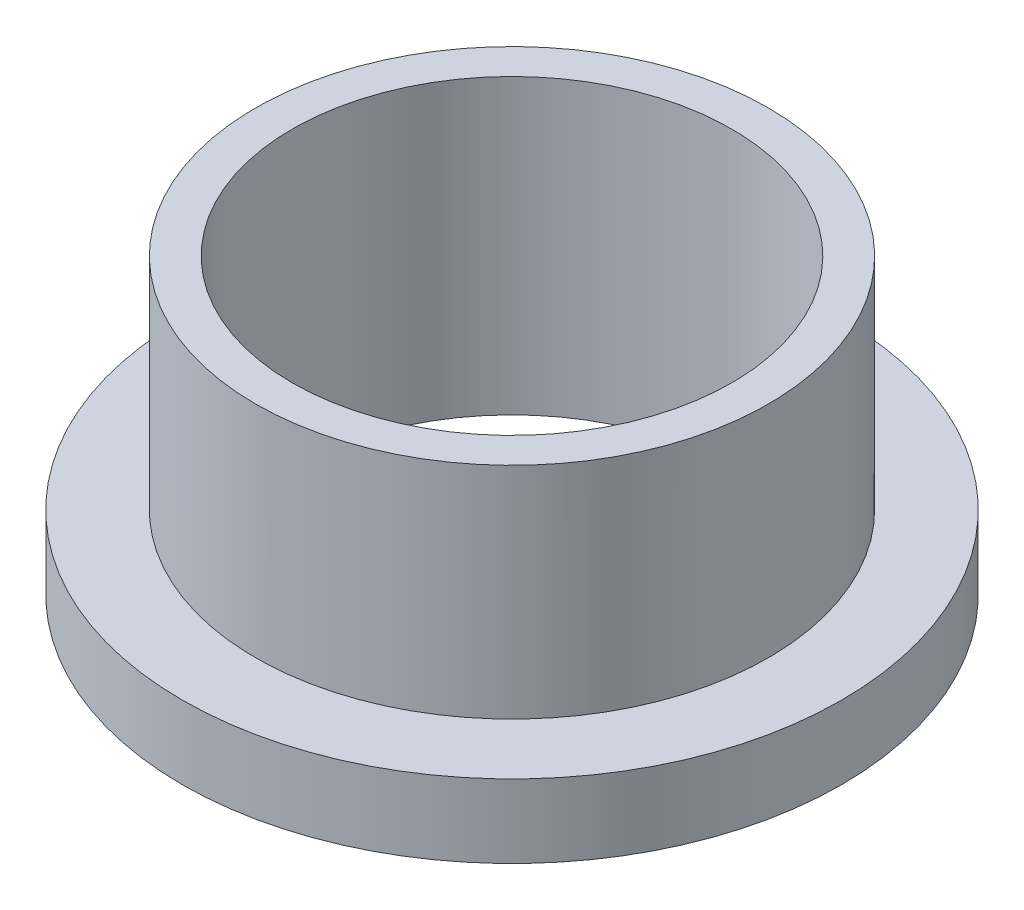
from build123d import *

# Parameters (mm, degrees)
SKETCH1_R           = 11.1125
SKETCH1_R_2         = 9.525
BOSS_EXTRUDE1_DEPTH = 12.7
SKETCH2_R           = 14.2875
SKETCH2_R_2         = 11.1125
BOSS_EXTRUDE2_DEPTH = 3.175


with BuildPart() as part:
    # Sketch1 → Boss-Extrude1 (new body)
    with BuildSketch(Plane(origin=(0, 0, 0), x_dir=(1, 0, 0), z_dir=(0, 1, 0))):
        Circle(SKETCH1_R)
        Circle(SKETCH1_R_2, mode=Mode.SUBTRACT)
    extrude(amount=BOSS_EXTRUDE1_DEPTH)

    # Sketch2 → Boss-Extrude2 (add)
    with BuildSketch(Plane.XZ):
        Circle(SKETCH2_R)
        Circle(SKETCH2_R_2, mode=Mode.SUBTRACT)
    extrude(amount=-BOSS_EXTRUDE2_DEPTH)


solid = part.part
